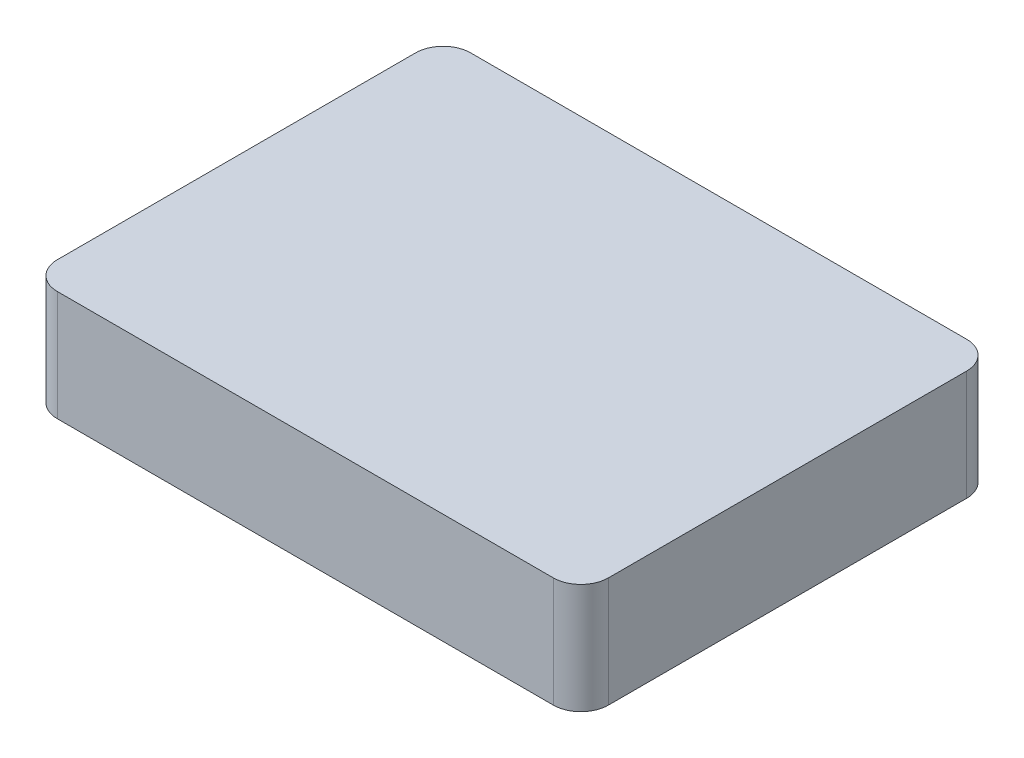
from build123d import *

# Parameters (mm, degrees)
SKETCH1_W           = 12.7
SKETCH1_H           = 9.525
BOSS_EXTRUDE1_DEPTH = 2.54
FILLET1_R           = 0.635
SHELL1_START        = 0.635
SHELL1_OUTLINE_W    = 1.905
SHELL1_OUTLINE_H    = 8.255
SHELL1_DEPTH        = 11.43
SKETCH2_R           = 2.54
BOSS_EXTRUDE2_DEPTH = 1.905


# Read off the part's stored shape, not the designer's step: Shell1
with BuildPart() as part:
    # Sketch1 → Boss-Extrude1 (new body)
    with BuildSketch(Plane(origin=(0, 0, 0), x_dir=(1, 0, 0), z_dir=(0, 1, 0))):
        with Locations((6.35, 4.7625)):
            Rectangle(SKETCH1_W, SKETCH1_H)
    extrude(amount=BOSS_EXTRUDE1_DEPTH)

    # Fillet1
    fillet1_edges = [part.edges().sort_by_distance(p)[0] for p in [
        (0, 1.27, -9.525),
        (12.7, 1.27, -9.525),
        (12.7, 1.27, 0),
        (0, 1.27, 0),
    ]]
    fillet(fillet1_edges, radius=FILLET1_R)

    # Shell1 outline → Shell1 (cut)
    with BuildSketch(Plane.YZ.offset(SHELL1_START)):
        with Locations((0.9525, -4.7625)):
            Rectangle(SHELL1_OUTLINE_W, SHELL1_OUTLINE_H)
    extrude(amount=SHELL1_DEPTH, mode=Mode.SUBTRACT)

    # Sketch2 → Boss-Extrude2 (add)
    with BuildSketch(Plane(origin=(0, 1.905, 0), x_dir=(-1, 0, 0), z_dir=(0, -1, 0))):
        with Locations(Location((-6.35, 4.7625, 0), (0, 0, 270))):
            Circle(SKETCH2_R)
    extrude(amount=BOSS_EXTRUDE2_DEPTH)


solid = part.part
